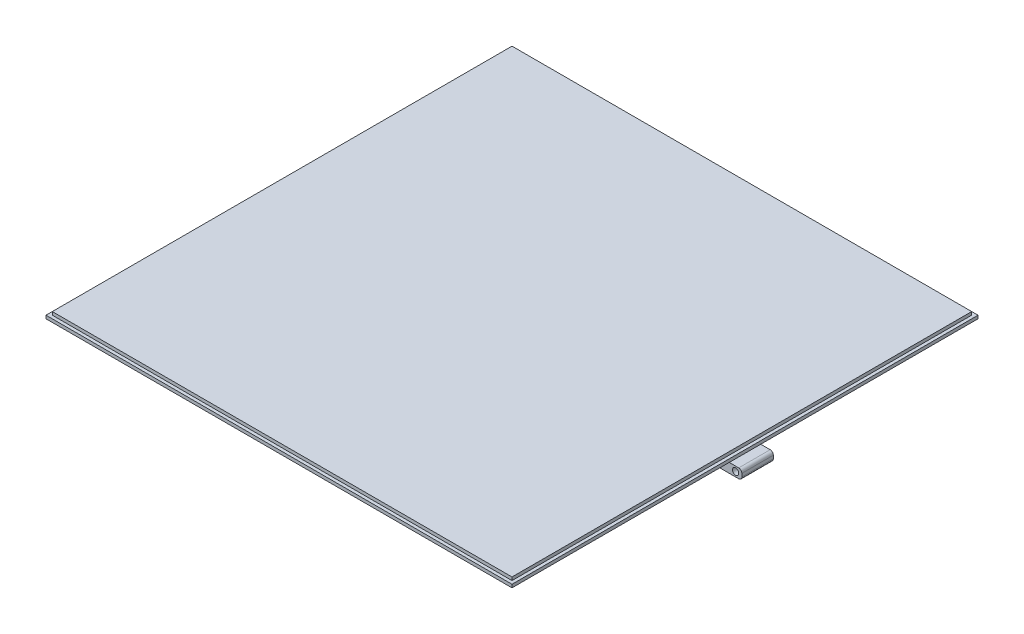
from build123d import *

# Parameters (mm, degrees)
SKETCH1_R           = 10
SKETCH1_R_2         = 7.5
BOSS_EXTRUDE1_DEPTH = 25
THREAD1_PITCH       = 0.3175
SKETCH4_W           = 146
SKETCH4_H           = 146
BOSS_EXTRUDE2_DEPTH = 2
SKETCH5_W           = 148
SKETCH5_H           = 148
BOSS_EXTRUDE3_DEPTH = 1
SKETCH6_W           = 10
SKETCH6_H           = 3
SKETCH6_R           = 1
BOSS_EXTRUDE4_DEPTH = 5
CHAMFER2_START      = -5
CHAMFER2_DEPTH      = 10
SKETCH9_R           = 10
CUT_EXTRUDE1_DEPTH  = 111.385687501
FILLET1_R           = 1


with BuildPart() as part:
    # Sketch1 → Boss-Extrude1 (new body)
    with BuildSketch(Plane(origin=(0, 0, 0), x_dir=(1, 0, 0), z_dir=(0, 1, 0))):
        with Locations(Location((0, 0, 0), (0, 0, 270))):
            Circle(SKETCH1_R)
        with Locations(Location((0, 0, 0), (0, 0, 270))):
            Circle(SKETCH1_R_2, mode=Mode.SUBTRACT)
    extrude(amount=BOSS_EXTRUDE1_DEPTH)

    # Thread1: arcs per turn and ends read off the stored shape
    # Thread1: the profile of Thread Profile1 profile screwed along a right-hand helix through 18.897638 turns, 6 arcs to a turn; built about Z, then put on its axis
    thread1_z = Axis((0, 0, 0), (0, 0, 1))
    thread1_corners = [(10.0003, 0, -0.000173205), (10.0003, 0, 0.277985704), (9.828148085, 0, 0.17859375), (9.828148085, 0, 0.09921875)]
    with BuildLine(mode=Mode.PRIVATE) as thread1_profile:
        Line(thread1_corners[0], thread1_corners[1])
        Line(thread1_corners[1], thread1_corners[2])
        Line(thread1_corners[2], thread1_corners[3])
        Line(thread1_corners[3], thread1_corners[0])
    thread1_cap = Face(thread1_profile.wire())
    thread1_turn_angles = [0, 30, 60, 90, 120, 150, 180, 210, 240, 270, 300, 330, 360]
    thread1_turn_weights = [1, 0.8660254037844387, 1, 0.8660254037844387, 1, 0.8660254037844387, 1, 0.8660254037844387, 1, 0.8660254037844387, 1, 0.8660254037844387, 1]
    thread1_turn_rails = [Edge.make_bspline([Vector(p[0], p[1], 0).rotate(thread1_z, thread1_turn_angles[k]) / thread1_turn_weights[k] + Vector(0, 0, p[2] + THREAD1_PITCH * thread1_turn_angles[k] / 360) for k in range(13)], [0, 0, 0, 1, 1, 2, 2, 3, 3, 4, 4, 5, 5, 6, 6, 6], 2, thread1_turn_weights) for p in thread1_corners]
    thread1_turn_sides = [Face.make_surface_from_curves(thread1_turn_rails[p[0]], thread1_turn_rails[p[1]]) for p in [(0, 1), (1, 2), (2, 3), (3, 0)]]
    thread1_last_angles = [6480, 6510, 6540, 6570, 6600, 6630, 6660, 6690, 6720, 6750, 6780, 6791.57480315, 6803.149606299]
    thread1_last_weights = [1, 0.8660254037844387, 1, 0.8660254037844387, 1, 0.8660254037844387, 1, 0.8660254037844387, 1, 0.8660254037844387, 1, 0.9796635825089068, 1]
    thread1_last_rails = [Edge.make_bspline([Vector(p[0], p[1], 0).rotate(thread1_z, thread1_last_angles[k]) / thread1_last_weights[k] + Vector(0, 0, p[2] + THREAD1_PITCH * thread1_last_angles[k] / 360) for k in range(13)], [0, 0, 0, 1, 1, 2, 2, 3, 3, 4, 4, 5, 5, 6, 6, 6], 2, thread1_last_weights) for p in thread1_corners]
    thread1_last_sides = [Face.make_surface_from_curves(thread1_last_rails[p[0]], thread1_last_rails[p[1]]) for p in [(0, 1), (1, 2), (2, 3), (3, 0)]]
    thread1 = Plane(origin=(0, -0.5, 0), x_dir=(1, 0, 0), z_dir=(0, 1, 0)) * Solid(Shell([*[p.moved(Location((0, 0, THREAD1_PITCH * i))) for i in range(18) for p in thread1_turn_sides], *thread1_last_sides, thread1_cap, thread1_cap.rotate(thread1_z, 6803.149606299).moved(Location((0, 0, THREAD1_PITCH * 6803.149606299 / 360)))]))
    add(thread1, mode=Mode.SUBTRACT)

    # Sketch4 → Boss-Extrude2 (add)
    with BuildSketch(Plane(origin=(0, 25, 0), x_dir=(1, 0, 0), z_dir=(0, 1, 0))):
        Rectangle(SKETCH4_W, SKETCH4_H)
    extrude(amount=BOSS_EXTRUDE2_DEPTH)

    # Sketch5 → Boss-Extrude3 (add)
    with BuildSketch(Plane.XZ.offset(-25)):
        Rectangle(SKETCH5_W, SKETCH5_H)
    extrude(amount=-BOSS_EXTRUDE3_DEPTH)

    # Sketch6 → Boss-Extrude4 (add, symmetric)
    with BuildSketch(Plane.XY):
        with Locations((73, 23.5)):
            Rectangle(SKETCH6_W, SKETCH6_H)
        with Locations((76, 23.5)):
            Circle(SKETCH6_R, mode=Mode.SUBTRACT)
    extrude(amount=BOSS_EXTRUDE4_DEPTH, both=True)

    # Chamfer2: read off the stored shape, not the designer's step
    # Chamfer2 outline → Chamfer2 (add)
    with BuildSketch(Plane.XY.offset(CHAMFER2_START)):
        Polygon((68, 25), (65, 25), (68, 22), align=None)
    extrude(amount=CHAMFER2_DEPTH)

    # Sketch9 → Cut-Extrude1 (cut, through all)
    with BuildSketch(Plane.XZ.offset(-25)):
        Circle(SKETCH9_R)
    extrude(amount=CUT_EXTRUDE1_DEPTH, mode=Mode.SUBTRACT)

    # Fillet1
    fillet1_edges = [part.edges().sort_by_distance(p)[0] for p in [
        (78, 22, 0),
        (78, 25, 0),
    ]]
    fillet(fillet1_edges, radius=FILLET1_R)


solid = part.part
